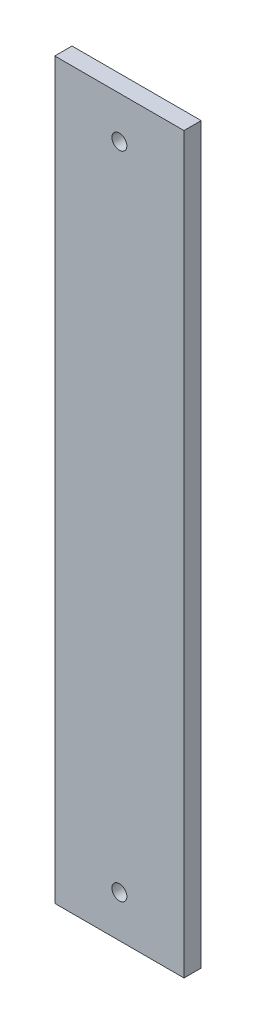
from build123d import *

# Parameters (mm, degrees)
ESBO_O1_W                = 45
ESBO_O1_H                = 255.6
ESBO_O1_R                = 2.6
RESSALTO_EXTRUS_O1_DEPTH = 6


with BuildPart() as part:
    # Esboço1 → Ressalto-extrusão1 (new body)
    with BuildSketch(Plane.XY):
        Rectangle(ESBO_O1_W, ESBO_O1_H)
        with Locations((0, 113.2)):
            Circle(ESBO_O1_R, mode=Mode.SUBTRACT)
        with Locations((0, -113.2)):
            Circle(ESBO_O1_R, mode=Mode.SUBTRACT)
    extrude(amount=RESSALTO_EXTRUS_O1_DEPTH)


solid = part.part
